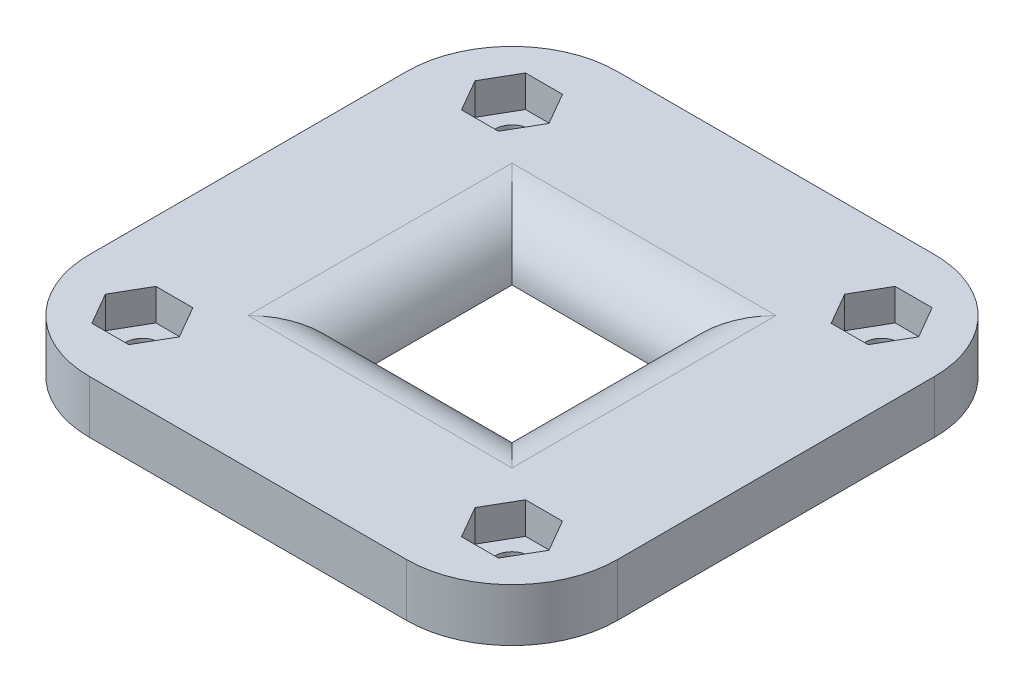
from build123d import *

# Parameters (mm, degrees)
SKETCH1_W           = 50
SKETCH1_H           = 50
BOSS_EXTRUDE1_DEPTH = 5
SKETCH2_R           = 1.6
CUT_EXTRUDE1_DEPTH  = 5
SKETCH4_W           = 15
SKETCH4_H           = 15
CUT_EXTRUDE2_DEPTH  = 5
CUT_EXTRUDE3_DEPTH  = 3
FILLET2_R           = 10
FILLET3_R           = 5


with BuildPart() as part:
    # Sketch1 → Boss-Extrude1 (new body)
    with BuildSketch(Plane(origin=(0, 0, 0), x_dir=(1, 0, 0), z_dir=(0, 1, 0))):
        with Locations((-39.516129032, 6.912442396)):
            Rectangle(SKETCH1_W, SKETCH1_H)
    extrude(amount=BOSS_EXTRUDE1_DEPTH)

    # Sketch2 → Cut-Extrude1 (cut)
    with BuildSketch(Plane(origin=(0, 5, 0), x_dir=(1, 0, 0), z_dir=(0, 1, 0))):
        with Locations(Location((-57.016129032, 24.412442396, 0), (0, 0, 270))):
            Circle(SKETCH2_R)
        with Locations(Location((-22.016129032, 24.412442396, 0), (0, 0, 270))):
            Circle(SKETCH2_R)
        with Locations(Location((-57.016129032, -10.587557604, 0), (0, 0, 270))):
            Circle(SKETCH2_R)
        with Locations(Location((-22.016129032, -10.587557604, 0), (0, 0, 270))):
            Circle(SKETCH2_R)
    extrude(amount=-CUT_EXTRUDE1_DEPTH, mode=Mode.SUBTRACT)

    # Sketch4 → Cut-Extrude2 (cut)
    with BuildSketch(Plane(origin=(0, 5, 0), x_dir=(1, 0, 0), z_dir=(0, 1, 0))):
        with Locations((-39.516129032, 6.912442396)):
            Rectangle(SKETCH4_W, SKETCH4_H)
    extrude(amount=-CUT_EXTRUDE2_DEPTH, mode=Mode.SUBTRACT)

    # Sketch5 → Cut-Extrude3 (cut)
    with BuildSketch(Plane(origin=(0, 5, 0), x_dir=(1, 0, 0), z_dir=(0, 1, 0))):
        Polygon((-58.766129032, 27.44353131), (-60.516129032, 24.412442396), (-58.766129032, 21.381353483), (-55.266129032, 21.381353483), (-53.516129032, 24.412442396), (-55.266129032, 27.44353131), align=None)
        Polygon((-23.766129032, 27.44353131), (-25.516129032, 24.412442396), (-23.766129032, 21.381353483), (-20.266129032, 21.381353483), (-18.516129032, 24.412442396), (-20.266129032, 27.44353131), align=None)
        Polygon((-58.766129032, -7.55646869), (-60.516129032, -10.587557604), (-58.766129032, -13.618646517), (-55.266129032, -13.618646517), (-53.516129032, -10.587557604), (-55.266129032, -7.55646869), align=None)
        Polygon((-23.766129032, -7.55646869), (-25.516129032, -10.587557604), (-23.766129032, -13.618646517), (-20.266129032, -13.618646517), (-18.516129032, -10.587557604), (-20.266129032, -7.55646869), align=None)
    extrude(amount=-CUT_EXTRUDE3_DEPTH, mode=Mode.SUBTRACT)

    # Fillet2
    fillet2_edges = [part.edges().sort_by_distance(p)[0] for p in [
        (-64.516129032, 2.5, -31.912442396),
        (-14.516129032, 2.5, -31.912442396),
        (-14.516129032, 2.5, 18.087557604),
        (-64.516129032, 2.5, 18.087557604),
    ]]
    fillet(fillet2_edges, radius=FILLET2_R)

    # Fillet3
    fillet3_edges = [part.edges().sort_by_distance(p)[0] for p in [
        (-39.516129032, 5, -14.412442396),
        (-32.016129032, 5, -6.912442396),
        (-39.516129032, 5, 0.587557604),
        (-47.016129032, 5, -6.912442396),
    ]]
    fillet(fillet3_edges, radius=FILLET3_R - 0.0001)  # a hair under: the kernel refuses the full size


solid = part.part
